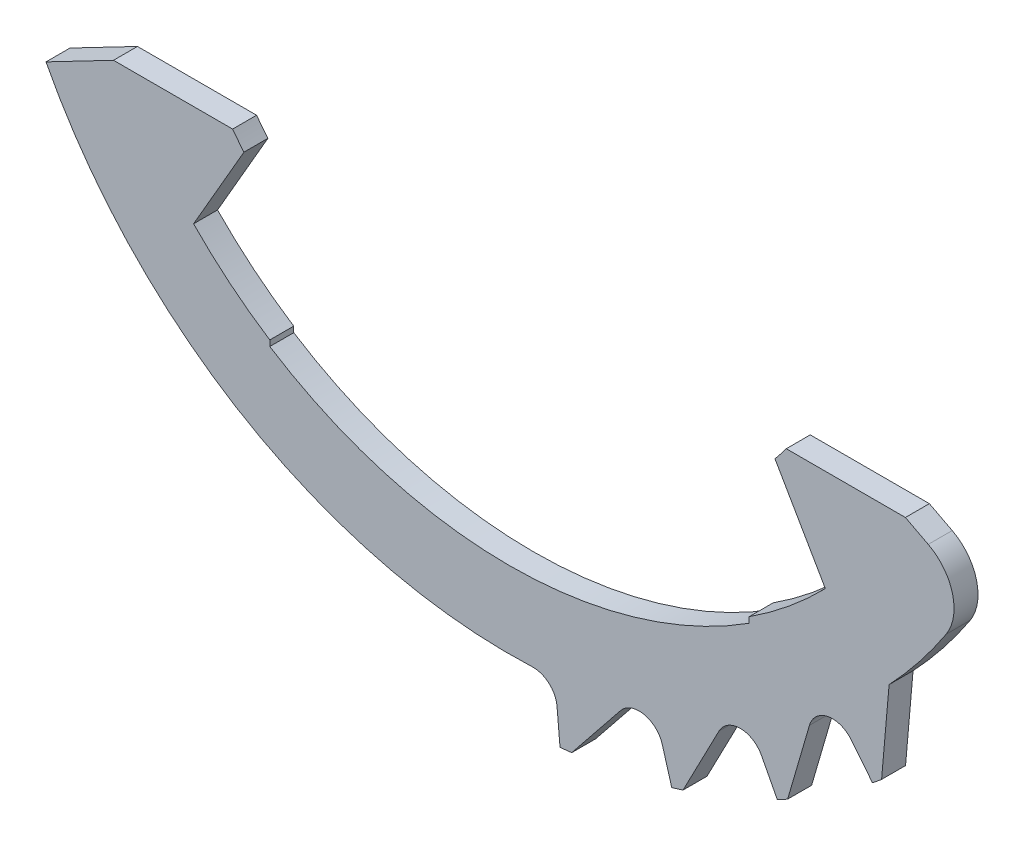
from build123d import *

# Parameters (mm, degrees)
OTHER_10076_5_DEPTH = 0.5
CUT_EXTRUDE1_START  = -0.5
CUT_EXTRUDE1_DEPTH  = 0.5


# Read off the part's stored shape, not the designer's step: 10076-5
with BuildPart() as part:
    # Other 10076-5 outline → Other 10076-5 (new body)
    with BuildSketch(Plane.XY):
        with BuildLine():
            ThreePointArc((7.573674013, -9.436602245), (7.668819519, -9.359444812), (7.763179028, -9.281328104))
            Line((7.763179028, -9.281328104), (7.919995926, -7.488902759))
            ThreePointArc((7.919995926, -7.488902759), (8.548470738, -6.76266575), (9.110578105, -5.983925684))
            ThreePointArc((9.110578105, -5.983925684), (9.242448569, -5.182849851), (8.736493865, -4.547930843))
            Line((8.736493865, -4.547930843), (8.260223146, -4.3))
            Line((8.260223146, -4.3), (5.774945887, -4.3))
            ThreePointArc((5.774945887, -4.3), (5.659072475, -4.451392897), (5.53923133, -4.5996648))
            Line((5.53923133, -4.5996648), (6.59, -6.419649523))
            ThreePointArc((6.59, -6.419649523), (5.831509763, -7.1157216), (5, -7.722693831))
            Line((5, -7.722693831), (5, -7.841555968))
            ThreePointArc((5, -7.841555968), (0, -9.3), (-5, -7.841555968))
            Line((-5, -7.841555968), (-5, -7.722693831))
            ThreePointArc((-5, -7.722693831), (-5.831509763, -7.1157216), (-6.59, -6.419649523))
            Line((-6.59, -6.419649523), (-5.53923133, -4.5996648))
            ThreePointArc((-5.53923133, -4.5996648), (-5.659072475, -4.451392897), (-5.774945887, -4.3))
            Line((-5.774945887, -4.3), (-8.260223146, -4.3))
            Line((-8.260223146, -4.3), (-10.732831081, -5.58715822))
            ThreePointArc((-10.732831081, -5.58715822), (-10.675718173, -5.6955282), (-10.617511084, -5.803314431))
            Line((-10.617511084, -5.803314431), (-9.055174855, -6.258693914))
            ThreePointArc((-9.055174855, -6.258693914), (-8.704696722, -6.64117368), (-8.882127626, -7.128661083))
            Line((-8.882127626, -7.128661083), (-9.436602245, -7.573674013))
            ThreePointArc((-9.436602245, -7.573674013), (-9.359444812, -7.668819519), (-9.281328104, -7.763179028))
            Line((-9.281328104, -7.763179028), (-7.660171598, -7.905011844))
            ThreePointArc((-7.660171598, -7.905011844), (-7.241809703, -8.211767477), (-7.320727248, -8.724502998))
            Line((-7.320727248, -8.724502998), (-7.777730077, -9.269137762))
            ThreePointArc((-7.777730077, -9.269137762), (-7.683493234, -9.347402405), (-7.588468891, -9.424709008))
            Line((-7.588468891, -9.424709008), (-5.970792243, -9.247544602))
            ThreePointArc((-5.970792243, -9.247544602), (-5.500623999, -9.466787654), (-5.477995427, -9.985067155))
            Line((-5.477995427, -9.985067155), (-5.819964104, -10.608393744))
            ThreePointArc((-5.819964104, -10.608393744), (-5.712269322, -10.666769858), (-5.603989074, -10.724052707))
            Line((-5.603989074, -10.724052707), (-4.05195869, -10.234699407))
            ThreePointArc((-4.05195869, -10.234699407), (-3.548052399, -10.358004491), (-3.424747314, -10.861910782))
            Line((-3.424747314, -10.861910782), (-3.638540174, -11.539975104))
            ThreePointArc((-3.638540174, -11.539975104), (-3.521526102, -11.576219327), (-3.404151099, -11.611277074))
            Line((-3.404151099, -11.611277074), (-1.977410637, -10.828540453))
            ThreePointArc((-1.977410637, -10.828540453), (-1.459131136, -10.851169025), (-1.239888083, -11.321337268))
            Line((-1.239888083, -11.321337268), (-1.317289186, -12.028081692))
            ThreePointArc((-1.317289186, -12.028081692), (-1.195452609, -12.04080118), (-1.073493507, -12.052286575))
            Line((-1.073493507, -12.052286575), (0.173128198, -11.006246762))
            ThreePointArc((0.173128198, -11.006246762), (0.685863719, -10.927329218), (0.992619352, -11.345691113))
            Line((0.992619352, -11.345691113), (1.054584487, -12.053955847))
            ThreePointArc((1.054584487, -12.053955847), (1.176561457, -12.042661796), (1.298417839, -12.030133462))
            Line((1.298417839, -12.030133462), (2.317013814, -10.760989181))
            ThreePointArc((2.317013814, -10.760989181), (2.804501216, -10.583558277), (3.186980982, -10.93403641))
            Line((3.186980982, -10.93403641), (3.38593107, -11.616603238))
            ThreePointArc((3.38593107, -11.616603238), (3.503360927, -11.581729673), (3.620431715, -11.545669067))
            Line((3.620431715, -11.545669067), (4.371857887, -10.10219282))
            ThreePointArc((4.371857887, -10.10219282), (4.815363304, -9.833067127), (5.258868721, -10.10219282))
            Line((5.258868721, -10.10219282), (5.58715822, -10.732831081))
            ThreePointArc((5.58715822, -10.732831081), (5.6955282, -10.675718173), (5.803314431, -10.617511084))
            Line((5.803314431, -10.617511084), (6.258693914, -9.055174855))
            ThreePointArc((6.258693914, -9.055174855), (6.64117368, -8.704696722), (7.128661083, -8.882127626))
            Line((7.128661083, -8.882127626), (7.573674013, -9.436602245))
        make_face()
    extrude(amount=OTHER_10076_5_DEPTH)

    # Sketch1 → Cut-Extrude1 (cut)
    with BuildSketch(Plane.XY.offset(0.5).offset(CUT_EXTRUDE1_START)):
        with BuildLine():
            Line((-9.668418082, -5.033059884), (-10.732831081, -5.58715822))
            ThreePointArc((-10.732831081, -5.58715822), (-6.730289461, -10.055506142), (-1.073493507, -12.052286575))
            Line((-1.073493507, -12.052286575), (0.173128198, -11.006246762))
            ThreePointArc((0.173128198, -11.006246762), (0.31335902, -10.923243262), (0.472832442, -10.889739643))
            ThreePointArc((0.472832442, -10.889739643), (-5.451135044, -9.439021493), (-9.668418082, -5.033059884))
        make_face()
    extrude(amount=CUT_EXTRUDE1_DEPTH, mode=Mode.SUBTRACT)


solid = part.part
